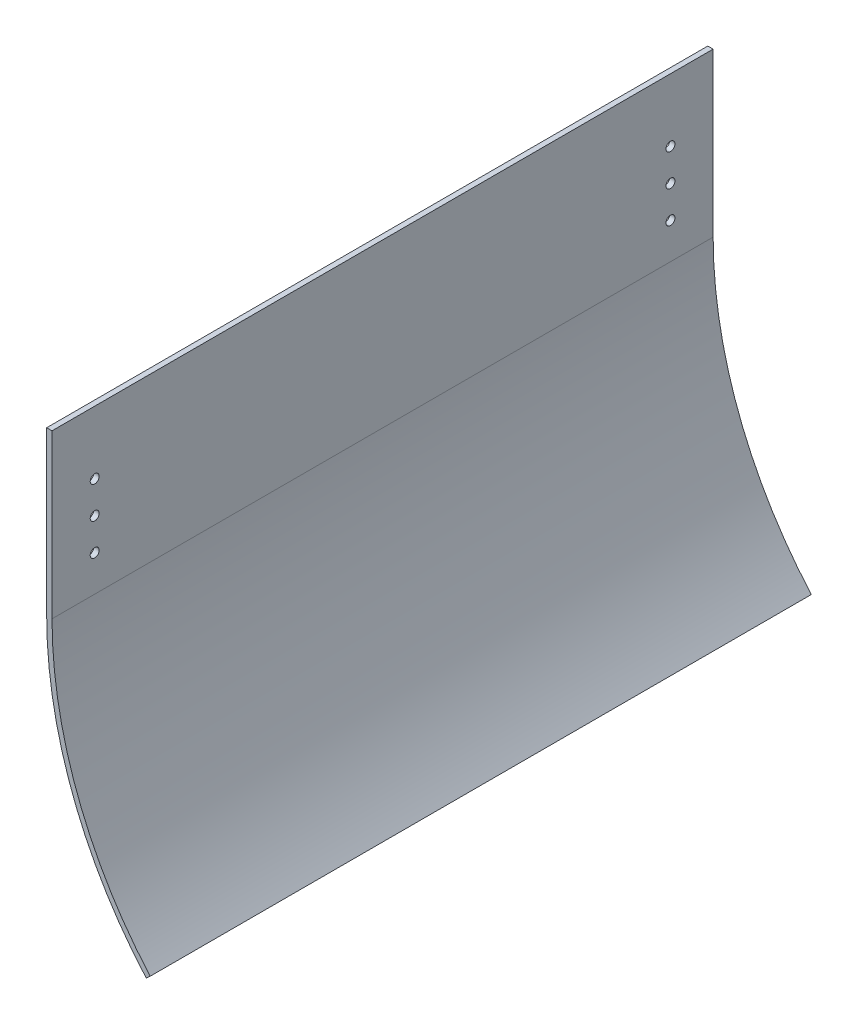
from build123d import *

# Parameters (mm, degrees)
BOSS_EXTRUDE1_DEPTH = 393.446
SKETCH2_R           = 2.667
CUT_EXTRUDE1_DEPTH  = 1537.643482365


with BuildPart() as part:
    # Sketch1 → Boss-Extrude1 (new body)
    with BuildSketch(Plane.XY):
        with BuildLine():
            Line((812.541689005, 1387.369803868), (812.541689005, 1484.270803868))
            Line((812.541689005, 1484.270803868), (815.716689005, 1484.270803868))
            Line((815.716689005, 1484.270803868), (815.716689005, 1387.369803868))
            ThreePointArc((815.716689005, 1387.369803868), (830.808178648, 1304.545262303), (874.142862637, 1232.366574946))
            Line((874.142862637, 1232.366574946), (871.757832535, 1230.270803868))
            ThreePointArc((871.757832535, 1230.270803868), (827.837227995, 1303.425406414), (812.541689005, 1387.369803868))
        make_face()
    extrude(amount=BOSS_EXTRUDE1_DEPTH)

    # Sketch2 → Cut-Extrude1 (cut, through all)
    with BuildSketch(Plane(origin=(815.716689005, 0, 0), x_dir=(0, 0, -1), z_dir=(1, 0, 0))):
        with Locations((-368.046, 1446.805803868)):
            Circle(SKETCH2_R)
        with Locations((-368.046, 1427.755803868)):
            Circle(SKETCH2_R)
        with Locations((-368.046, 1408.705803868)):
            Circle(SKETCH2_R)
        with Locations((-25.4, 1408.705803868)):
            Circle(SKETCH2_R)
        with Locations((-25.4, 1427.755803868)):
            Circle(SKETCH2_R)
        with Locations((-25.4, 1446.805803868)):
            Circle(SKETCH2_R)
    extrude(amount=-CUT_EXTRUDE1_DEPTH, mode=Mode.SUBTRACT)


solid = part.part
